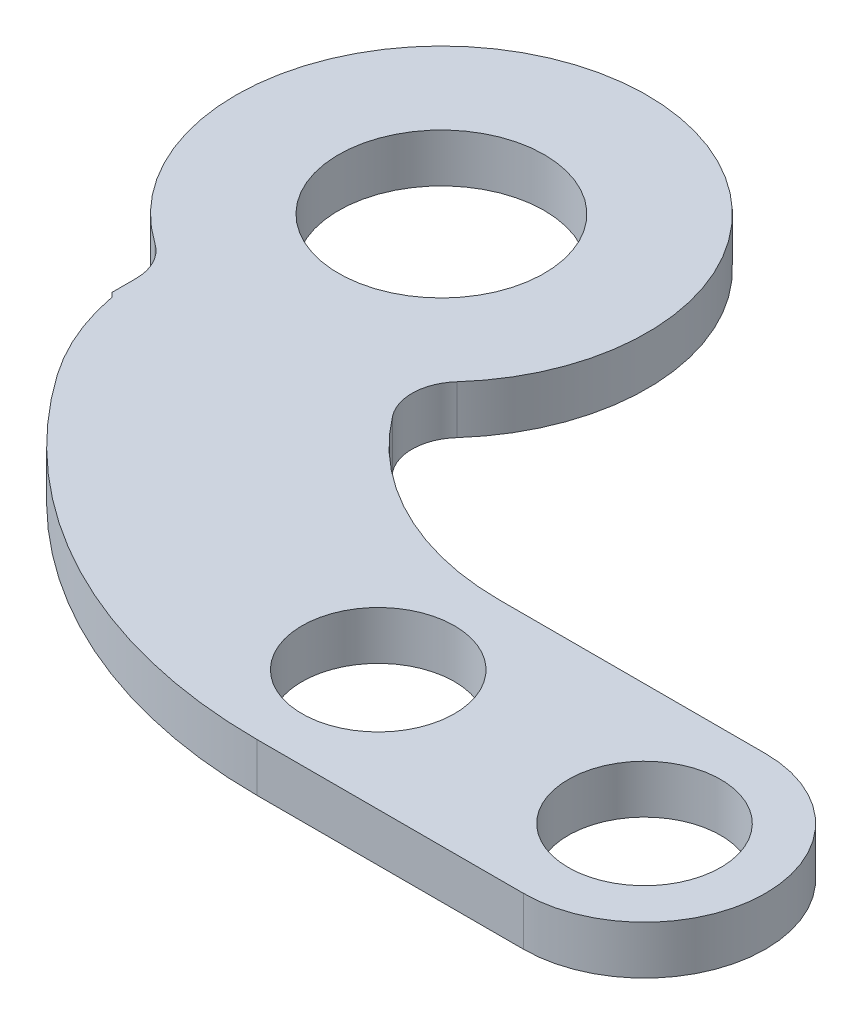
from build123d import *

# Parameters (mm, degrees)
SKETCH1_W           = 10.11
SKETCH1_H           = 2
EXTRUDE_THIN1_DEPTH = 8
CHAMFER1_SIZE       = 8
SKETCH2_R           = 3.15
BOSS_EXTRUDE1_DEPTH = 2
SKETCH6_R           = 8.5
SKETCH6_R_2         = 4.25
BOSS_EXTRUDE4_DEPTH = 2
FILLET4_R           = 2


with BuildPart() as part:
    # Sketch1 → Extrude-Thin1 (new body)
    with BuildSketch(Plane(origin=(0, 0, 0), x_dir=(0, 0, -1), z_dir=(1, 0, 0))):
        with Locations((-5.055, 0)):
            Rectangle(SKETCH1_W, SKETCH1_H)
    extrude(amount=EXTRUDE_THIN1_DEPTH)

    # Chamfer1
    chamfer1_edges = [part.edges().sort_by_distance(p)[0] for p in [
        (0, 0, 10.11),
    ]]
    chamfer(chamfer1_edges, length=CHAMFER1_SIZE - 0.0001)  # a hair under: the kernel refuses the full size

    # Sketch2 → Boss-Extrude1 (add)
    with BuildSketch(Plane(origin=(0, 1, 0), x_dir=(1, 0, 0), z_dir=(0, 1, 0))):
        with BuildLine():
            Line((0, -0.43455532), (0, 0))
            ThreePointArc((0, 0), (4.444005662, 0.947416312), (8.29515392, 3.358938877))
            ThreePointArc((8.29515392, 3.358938877), (12.175107047, -2.736751195), (19, -5.11))
            Line((19, -5.11), (30, -5.11))
            ThreePointArc((30, -5.11), (35, -10.11), (30, -15.11))
            Line((30, -15.11), (19, -15.11))
            ThreePointArc((19, -15.11), (9.319017932, -12.745412155), (1.818181818, -6.184151066))
            ThreePointArc((1.818181818, -6.184151066), (0.465374108, -3.449668766), (0, -0.43455532))
        make_face()
        with Locations(Location((30, -10.11, 0), (0, 0, 270))):
            Circle(SKETCH2_R, mode=Mode.SUBTRACT)
        with Locations(Location((19, -10.11, 0), (0, 0, 90))):
            Circle(SKETCH2_R, mode=Mode.SUBTRACT)
    extrude(amount=-BOSS_EXTRUDE1_DEPTH)

    # Sketch6 → Boss-Extrude4 (add)
    with BuildSketch(Plane.XZ.offset(1)):
        with Locations((4, -7.5)):
            Circle(SKETCH6_R)
        with Locations(Location((4, -7.5, 0), (0, 0, 270))):
            Circle(SKETCH6_R_2, mode=Mode.SUBTRACT)
    extrude(amount=-BOSS_EXTRUDE4_DEPTH)

    # Fillet4
    fillet4_edges = [part.edges().sort_by_distance(p)[0] for p in [
        (0, 0, 0),
        (9.243332379, 0, -0.809897941),
    ]]
    fillet(fillet4_edges, radius=FILLET4_R)


solid = part.part
